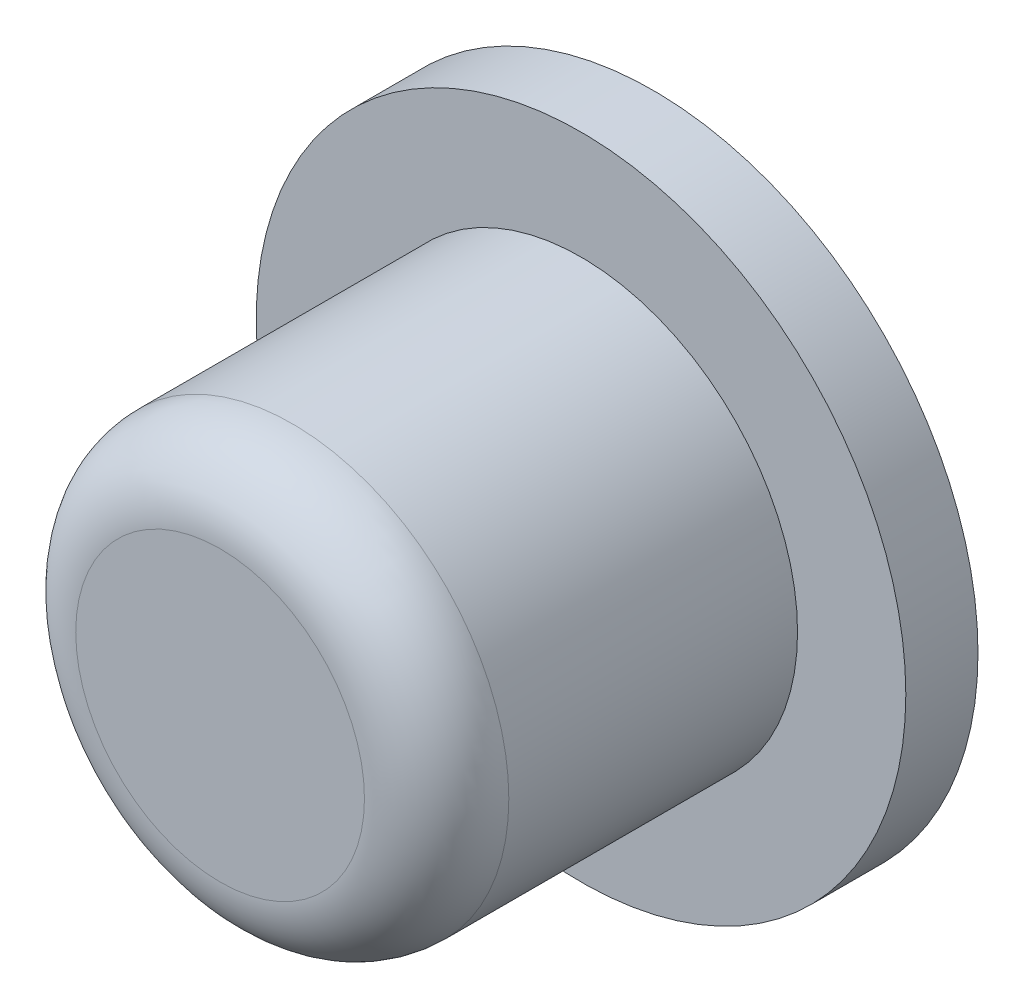
from build123d import *

# Parameters (mm, degrees)
SKETCH_1_R          = 3
EXTRUDE_1_DEPTH     = 6
SKETCH_1_4_R        = 1.9
CUT_EXTRUDE_1_DEPTH = 1.5
SKETCH_1_5_R        = 4.5
SKETCH_1_5_R_2      = 3
EXTRUDE_2_DEPTH     = 1
FILLET_1_R          = 1


with BuildPart() as part:
    # 草图1 → 凸台-拉伸1 (new body)
    with BuildSketch(Plane.XY):
        Circle(SKETCH_1_R)
    extrude(amount=EXTRUDE_1_DEPTH)

    # 草图1<4> → 切除-拉伸1 (cut)
    with BuildSketch(Plane.XY):
        Circle(SKETCH_1_4_R)
    extrude(amount=CUT_EXTRUDE_1_DEPTH, mode=Mode.SUBTRACT)

    # 草图1<5> → 凸台-拉伸2 (add)
    with BuildSketch(Plane.XY):
        Circle(SKETCH_1_5_R)
        Circle(SKETCH_1_5_R_2, mode=Mode.SUBTRACT)
    extrude(amount=EXTRUDE_2_DEPTH)

    # 圆角1
    fillet_1_edges = [part.edges().sort_by_distance(p)[0] for p in [
        (-3, 0, 6),
    ]]
    fillet(fillet_1_edges, radius=FILLET_1_R)


solid = part.part
